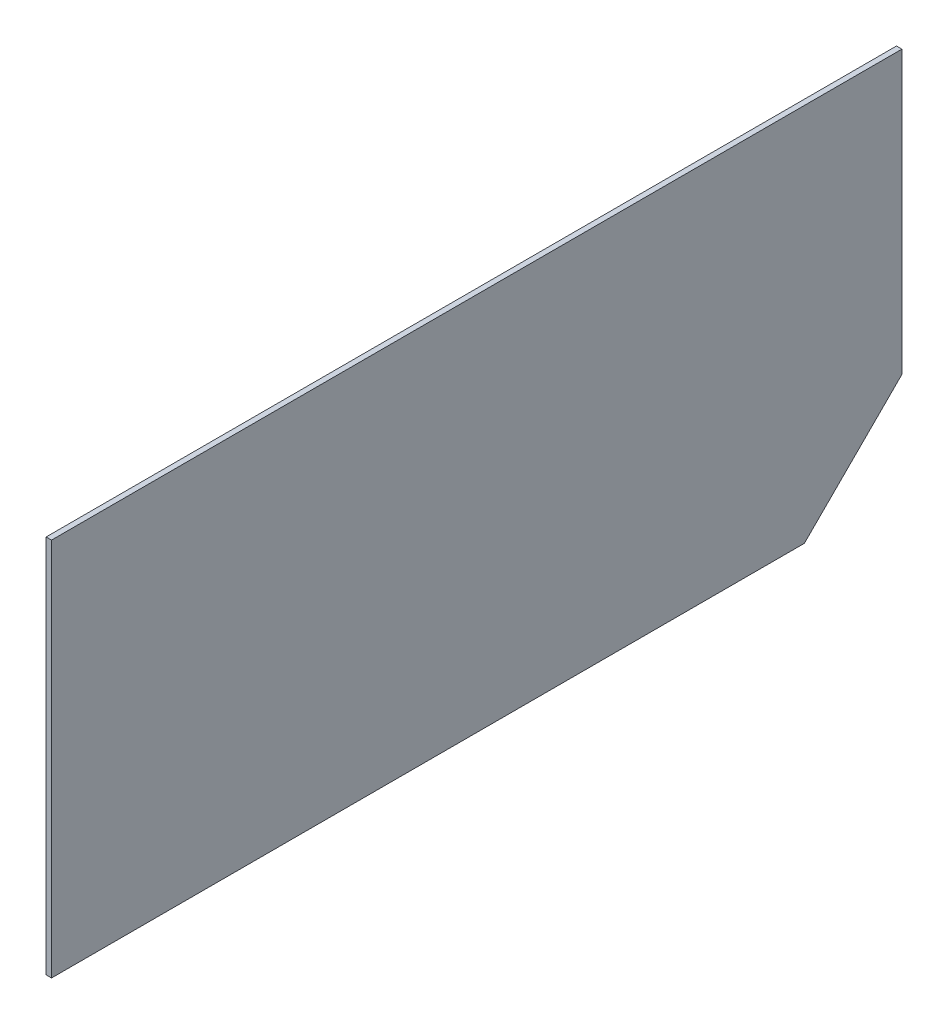
from build123d import *

# Parameters (mm, degrees)
SKETCH1_W           = 498.348
SKETCH1_H           = 165.1
BOSS_EXTRUDE1_DEPTH = 1.5875
BOSS_EXTRUDE2_DEPTH = 3.175


with BuildPart() as part:
    # Sketch1 → Boss-Extrude1 (new, symmetric)
    with BuildSketch(Plane(origin=(0, 0, 0), x_dir=(0, 0, -1), z_dir=(1, 0, 0))):
        Rectangle(SKETCH1_W, SKETCH1_H)
    extrude(amount=BOSS_EXTRUDE1_DEPTH, both=True)

    # Sketch2 → Boss-Extrude2 (add)
    with BuildSketch(Plane(origin=(1.5875, 0, 0), x_dir=(0, 0, -1), z_dir=(1, 0, 0))):
        Polygon((192.024, -139.7), (249.174, -82.55), (-249.174, -82.55), (-249.174, -139.7), align=None)
    extrude(amount=-BOSS_EXTRUDE2_DEPTH)


solid = part.part
